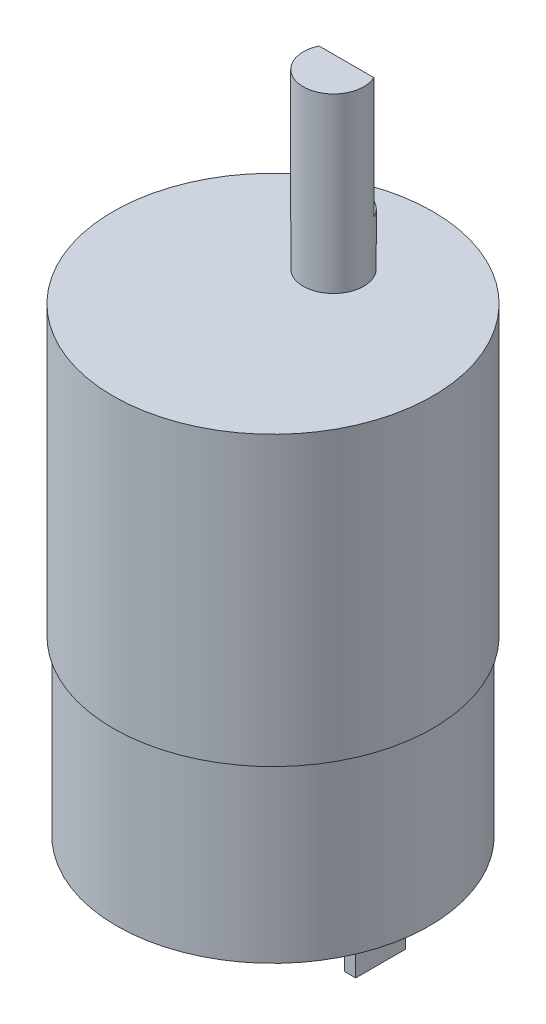
from build123d import *

# Parameters (mm, degrees)
SKETCH1_R               = 18.1
BOSS_EXTRUDE1_DEPTH     = 20
SKETCH2_R               = 18.5
BOSS_EXTRUDE2_DEPTH     = 33.3
SKETCH3_R               = 4.666403254
BOSS_EXTRUDE3_DEPTH     = 3.81
SKETCH4_W               = 1.27
SKETCH4_H               = 5.788702771
BOSS_EXTRUDE4_DEPTH     = 6.35
SKETCH5_R               = 3.5
BOSS_EXTRUDE5_DEPTH     = 20
CUT_EXTRUDE1_DEPTH      = 78.829236152
CUT_EXTRUDE1_DEPTH_BACK = 78.829236152
SKETCH7_W               = 2
SKETCH7_H               = 14


with BuildPart() as part:
    # Sketch1 → Boss-Extrude1 (new body)
    with BuildSketch(Plane(origin=(0, 0, 0), x_dir=(1, 0, 0), z_dir=(0, 1, 0))):
        Circle(SKETCH1_R)
    extrude(amount=BOSS_EXTRUDE1_DEPTH)

    # Sketch2 → Boss-Extrude2 (add)
    with BuildSketch(Plane(origin=(0, 20, 0), x_dir=(1, 0, 0), z_dir=(0, 1, 0))):
        Circle(SKETCH2_R)
    extrude(amount=BOSS_EXTRUDE2_DEPTH)

    # Sketch3 → Boss-Extrude3 (add)
    with BuildSketch(Plane.XZ):
        Circle(SKETCH3_R)
    extrude(amount=BOSS_EXTRUDE3_DEPTH)

    # Sketch4 → Boss-Extrude4 (add)
    with BuildSketch(Plane.XZ):
        with Locations((-12.065, 0.236273582)):
            Rectangle(SKETCH4_W, SKETCH4_H)
        with Locations((12.065, 0.236273582)):
            Rectangle(SKETCH4_W, SKETCH4_H)
    extrude(amount=BOSS_EXTRUDE4_DEPTH)

    # Sketch5 → Boss-Extrude5 (add)
    with BuildSketch(Plane(origin=(0, 53.3, 0), x_dir=(1, 0, 0), z_dir=(0, 1, 0))):
        with Locations((0, 7)):
            Circle(SKETCH5_R)
    extrude(amount=BOSS_EXTRUDE5_DEPTH)

    # Sketch7 → Cut-Extrude1 (cut, two sides: drawn at the far end of the back side and taken through both)
    with BuildSketch(Plane(origin=(0, 0, 0), x_dir=(0, 0, -1), z_dir=(1, 0, 0)).offset(-CUT_EXTRUDE1_DEPTH_BACK)):
        with Locations((9.5, 66.3)):
            Rectangle(SKETCH7_W, SKETCH7_H)
    extrude(amount=CUT_EXTRUDE1_DEPTH + CUT_EXTRUDE1_DEPTH_BACK, mode=Mode.SUBTRACT)


solid = part.part
